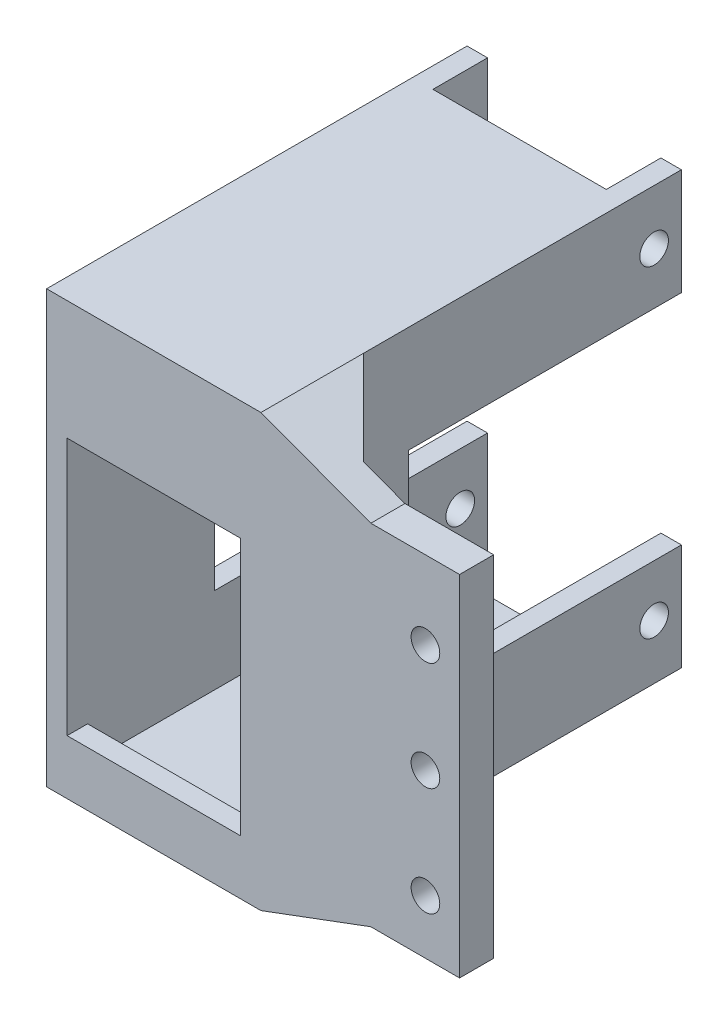
from build123d import *

# Parameters (mm, degrees)
SKETCH1_W           = 51.2
SKETCH1_H           = 13
SKETCH1_R           = 2.1
SKETCH1_W_2         = 5
SKETCH1_H_2         = 25.4
BOSS_EXTRUDE1_DEPTH = 3
BOSS_EXTRUDE2_DEPTH = 61.6
SKETCH2_R           = 2.1
SKETCH2_W           = 32
SKETCH2_H           = 40
CUT_EXTRUDE1_DEPTH  = 100
SKETCH3_W           = 63.2
SKETCH3_H           = 25.4
CUT_EXTRUDE2_DEPTH  = 8
SKETCH1_5_W         = 51.2
SKETCH1_5_H         = 13
SKETCH1_5_R         = 2.1
BOSS_EXTRUDE3_DEPTH = 5
CHAMFER1_SIZE       = 10


with BuildPart() as part:
    # Sketch1 → Boss-Extrude1 (new body)
    # profile 1 of 9: a face of its own
    with BuildSketch(Plane(origin=(0, 0, 0), x_dir=(0, 1, 0), z_dir=(0, 0, 1))):
        with BuildLine():
            Line((41.3, -15.7), (27.654113618, -15.7))
            ThreePointArc((27.654113618, -15.7), (15.999687497, -27.481812167), (0, -31.8))
            Line((0, -31.8), (35.3, -31.8))
            Line((35.3, -31.8), (41.3, -15.7))
        make_face()
    # profile 2 of 9: a face of its own
    with BuildSketch(Plane(origin=(0, 0, 0), x_dir=(0, 1, 0), z_dir=(0, 0, 1))):
        with BuildLine():
            Line((27.654113618, -15.7), (-21.9, -15.7))
            Line((-21.9, -15.7), (-17.974836126, -26.232523063))
            ThreePointArc((-17.974836126, -26.232523063), (-9.408660016, -30.376259097), (0, -31.8))
            ThreePointArc((0, -31.8), (15.999687497, -27.481812167), (27.654113618, -15.7))
        make_face()
    # profile 3 of 9: a face of its own
    with BuildSketch(Plane(origin=(0, 0, 0), x_dir=(0, 1, 0), z_dir=(0, 0, 1))):
        with BuildLine():
            ThreePointArc((0, -31.8), (-9.408660016, -30.376259097), (-17.974836126, -26.232523063))
            Line((-17.974836126, -26.232523063), (-15.9, -31.8))
            Line((-15.9, -31.8), (0, -31.8))
        make_face()
    # profile 4 of 9: a face of its own
    with BuildSketch(Plane(origin=(0, 0, 0), x_dir=(0, 1, 0), z_dir=(0, 0, 1))):
        with Locations((9.7, -38.3)):
            Rectangle(SKETCH1_W, SKETCH1_H)
        with Locations(Location((23.85, -39.8, 0), (0, 0, 270))):
            Circle(SKETCH1_R, mode=Mode.SUBTRACT)
        with Locations(Location((7.95, -39.8, 0), (0, 0, 270))):
            Circle(SKETCH1_R, mode=Mode.SUBTRACT)
        with Locations(Location((-7.95, -39.8, 0), (0, 0, 270))):
            Circle(SKETCH1_R, mode=Mode.SUBTRACT)
    # profile 5 of 9: a face of its own
    with BuildSketch(Plane(origin=(0, 0, 0), x_dir=(0, 1, 0), z_dir=(0, 0, 1))):
        with BuildLine():
            ThreePointArc((29.153901969, -12.7), (28.443587304, -14.219786963), (27.654113618, -15.7))
            Line((27.654113618, -15.7), (41.3, -15.7))
            Line((41.3, -15.7), (41.3, 15.7))
            Line((41.3, 15.7), (27.654113618, 15.7))
            ThreePointArc((27.654113618, 15.7), (28.443587304, 14.219786963), (29.153901969, 12.7))
            Line((29.153901969, 12.7), (38.3, 12.7))
            Line((38.3, 12.7), (38.3, -12.7))
            Line((38.3, -12.7), (29.153901969, -12.7))
        make_face()
    # profile 6 of 9: a face of its own
    with BuildSketch(Plane(origin=(0, 0, 0), x_dir=(0, 1, 0), z_dir=(0, 0, 1))):
        with BuildLine():
            Line((-21.9, 15.7), (-21.9, -15.7))
            Line((-21.9, -15.7), (27.654113618, -15.7))
            ThreePointArc((27.654113618, -15.7), (28.443587304, -14.219786963), (29.153901969, -12.7))
            Line((29.153901969, -12.7), (23.85, -12.7))
            Line((23.85, -12.7), (-13.9, -12.7))
            Line((-13.9, -12.7), (-18.9, -12.7))
            Line((-18.9, -12.7), (-18.9, 12.7))
            Line((-18.9, 12.7), (-13.9, 12.7))
            Line((-13.9, 12.7), (23.85, 12.7))
            Line((23.85, 12.7), (29.153901969, 12.7))
            ThreePointArc((29.153901969, 12.7), (28.443587304, 14.219786963), (27.654113618, 15.7))
            Line((27.654113618, 15.7), (-21.9, 15.7))
        make_face()
    # profile 7 of 9: a face of its own
    with BuildSketch(Plane(origin=(0, 0, 0), x_dir=(0, 1, 0), z_dir=(0, 0, 1))):
        with BuildLine():
            Line((23.85, -12.7), (29.153901969, -12.7))
            ThreePointArc((29.153901969, -12.7), (31.131447787, -6.486367142), (31.8, 0))
            ThreePointArc((31.8, 0), (31.131447787, 6.486367142), (29.153901969, 12.7))
            Line((29.153901969, 12.7), (23.85, 12.7))
            Line((23.85, 12.7), (23.85, -12.7))
        make_face()
    # profile 8 of 9: a face of its own
    with BuildSketch(Plane(origin=(0, 0, 0), x_dir=(0, 1, 0), z_dir=(0, 0, 1))):
        with BuildLine():
            ThreePointArc((31.8, 0), (31.131447787, -6.486367142), (29.153901969, -12.7))
            Line((29.153901969, -12.7), (38.3, -12.7))
            Line((38.3, -12.7), (38.3, 12.7))
            Line((38.3, 12.7), (29.153901969, 12.7))
            ThreePointArc((29.153901969, 12.7), (31.131447787, 6.486367142), (31.8, 0))
        make_face()
    # profile 9 of 9: a face of its own
    with BuildSketch(Plane(origin=(0, 0, 0), x_dir=(0, 1, 0), z_dir=(0, 0, 1))):
        with Locations((-16.4, 0)):
            Rectangle(SKETCH1_W_2, SKETCH1_H_2)
    extrude(amount=-BOSS_EXTRUDE1_DEPTH)

    # Sketch1<4> → Boss-Extrude2 (add)
    with BuildSketch(Plane(origin=(0, 0, 0), x_dir=(0, 1, 0), z_dir=(0, 0, 1))):
        with BuildLine():
            ThreePointArc((29.153901969, -12.7), (28.443587304, -14.219786963), (27.654113618, -15.7))
            Line((27.654113618, -15.7), (41.3, -15.7))
            Line((41.3, -15.7), (41.3, 15.7))
            Line((41.3, 15.7), (27.654113618, 15.7))
            ThreePointArc((27.654113618, 15.7), (28.443587304, 14.219786963), (29.153901969, 12.7))
            Line((29.153901969, 12.7), (38.3, 12.7))
            Line((38.3, 12.7), (38.3, -12.7))
            Line((38.3, -12.7), (29.153901969, -12.7))
        make_face()
        with BuildLine():
            Line((-21.9, 15.7), (-21.9, -15.7))
            Line((-21.9, -15.7), (27.654113618, -15.7))
            ThreePointArc((27.654113618, -15.7), (28.443587304, -14.219786963), (29.153901969, -12.7))
            Line((29.153901969, -12.7), (23.85, -12.7))
            Line((23.85, -12.7), (-13.9, -12.7))
            Line((-13.9, -12.7), (-18.9, -12.7))
            Line((-18.9, -12.7), (-18.9, 12.7))
            Line((-18.9, 12.7), (-13.9, 12.7))
            Line((-13.9, 12.7), (23.85, 12.7))
            Line((23.85, 12.7), (29.153901969, 12.7))
            ThreePointArc((29.153901969, 12.7), (28.443587304, 14.219786963), (27.654113618, 15.7))
            Line((27.654113618, 15.7), (-21.9, 15.7))
        make_face()
    extrude(amount=-BOSS_EXTRUDE2_DEPTH)

    # Sketch2 → Cut-Extrude1 (cut)
    with BuildSketch(Plane(origin=(-15.7, 0, 0), x_dir=(0, -1, 0), z_dir=(-1, 0, 0))):
        with Locations(Location((13.9, -57.6, 0), (0, 0, 270))):
            Circle(SKETCH2_R)
        with Locations(Location((-33.3, -57.6, 0), (0, 0, 270))):
            Circle(SKETCH2_R)
        with Locations((-9.7, -41.6)):
            Rectangle(SKETCH2_W, SKETCH2_H)
    extrude(amount=-CUT_EXTRUDE1_DEPTH, mode=Mode.SUBTRACT)

    # Sketch3 → Cut-Extrude2 (cut)
    with BuildSketch(Plane.YX.offset(61.6)):
        with Locations((9.7, 0)):
            Rectangle(SKETCH3_W, SKETCH3_H)
    extrude(amount=-CUT_EXTRUDE2_DEPTH, mode=Mode.SUBTRACT)

    # Sketch1<5> → Boss-Extrude3 (add)
    # profile 1 of 4: a face of its own
    with BuildSketch(Plane(origin=(0, 0, 0), x_dir=(0, 1, 0), z_dir=(0, 0, 1))):
        with BuildLine():
            Line((27.654113618, -15.7), (-21.9, -15.7))
            Line((-21.9, -15.7), (-17.974836126, -26.232523063))
            ThreePointArc((-17.974836126, -26.232523063), (-9.408660016, -30.376259097), (0, -31.8))
            ThreePointArc((0, -31.8), (15.999687497, -27.481812167), (27.654113618, -15.7))
        make_face()
    # profile 2 of 4: a face of its own
    with BuildSketch(Plane(origin=(0, 0, 0), x_dir=(0, 1, 0), z_dir=(0, 0, 1))):
        with BuildLine():
            Line((41.3, -15.7), (27.654113618, -15.7))
            ThreePointArc((27.654113618, -15.7), (15.999687497, -27.481812167), (0, -31.8))
            Line((0, -31.8), (35.3, -31.8))
            Line((35.3, -31.8), (41.3, -15.7))
        make_face()
    # profile 3 of 4: a face of its own
    with BuildSketch(Plane(origin=(0, 0, 0), x_dir=(0, 1, 0), z_dir=(0, 0, 1))):
        with BuildLine():
            ThreePointArc((0, -31.8), (-9.408660016, -30.376259097), (-17.974836126, -26.232523063))
            Line((-17.974836126, -26.232523063), (-15.9, -31.8))
            Line((-15.9, -31.8), (0, -31.8))
        make_face()
    # profile 4 of 4: a face of its own
    with BuildSketch(Plane(origin=(0, 0, 0), x_dir=(0, 1, 0), z_dir=(0, 0, 1))):
        with Locations((9.7, -38.3)):
            Rectangle(SKETCH1_5_W, SKETCH1_5_H)
        with Locations(Location((23.85, -39.8, 0), (0, 0, 270))):
            Circle(SKETCH1_5_R, mode=Mode.SUBTRACT)
        with Locations(Location((7.95, -39.8, 0), (0, 0, 270))):
            Circle(SKETCH1_5_R, mode=Mode.SUBTRACT)
        with Locations(Location((-7.95, -39.8, 0), (0, 0, 270))):
            Circle(SKETCH1_5_R, mode=Mode.SUBTRACT)
    extrude(amount=-BOSS_EXTRUDE3_DEPTH)

    # Chamfer1
    # the kernel refuses this chamfer: 10 mm, written as the material it adds along each edge
    with BuildSketch(Plane(origin=(15.7, -21.9, -5), x_dir=(-0.027495876610586317, 0, -0.9996219169112968), z_dir=(0, 1, 0))) as chamfer1_piece_1_section:
        Polygon((CHAMFER1_SIZE * 0.999621916911, -CHAMFER1_SIZE * 0.0274958766106), (-CHAMFER1_SIZE * 0.0274958766106, -CHAMFER1_SIZE * 0.999621916911), (0, 0), align=None)
    chamfer1_piece_1 = extrude(amount=63.2, mode=Mode.PRIVATE)
    chamfer1_piece_1 = split(chamfer1_piece_1, bisect_by=Plane(origin=(28.867881951, -16.992714801, -8.339298449), z_dir=(-0.34920923314434543, 0.9370447756039934, 0)), keep=Keep.TOP, mode=Mode.PRIVATE)
    chamfer1_piece_1 = split(chamfer1_piece_1, bisect_by=Plane(origin=(28.867881951, 36.392714801, -8.339298449), z_dir=(-0.3492092331443461, -0.9370447756039931, 0)), keep=Keep.TOP, mode=Mode.PRIVATE)
    add(chamfer1_piece_1)


solid = part.part
